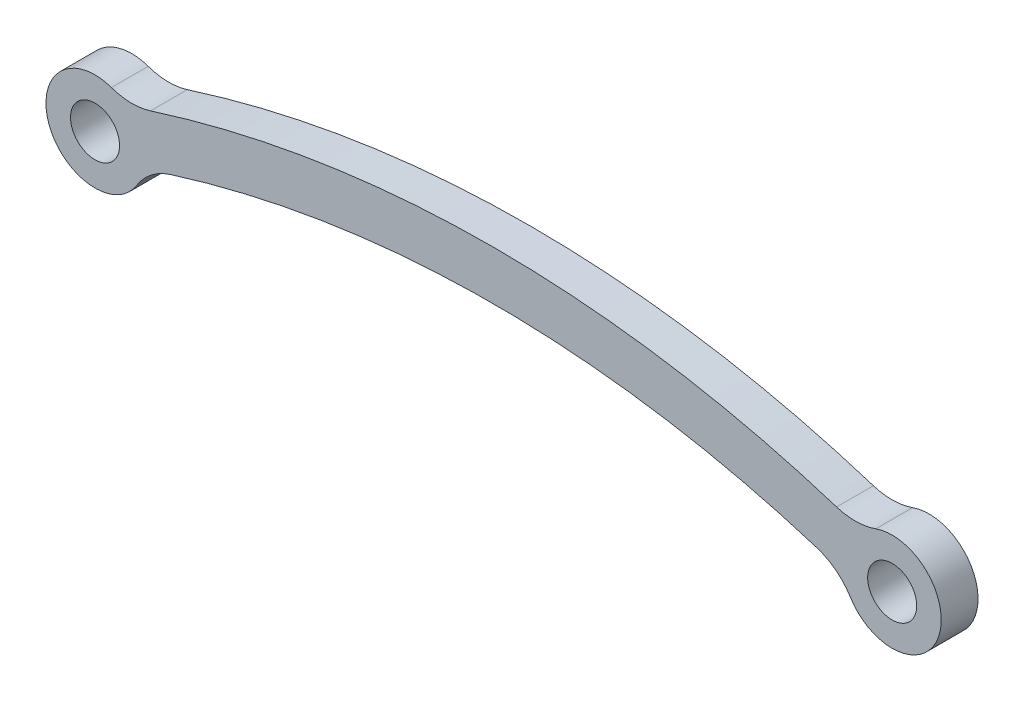
from build123d import *

# Parameters (mm, degrees)
SKETCH_1_R          = 8
EXTRUDE_1_DEPTH     = 6
SKETCH_2_R          = 4
CUT_EXTRUDE_1_DEPTH = 15
FILLET_1_R          = 10
EXTRUDE_START       = -6
EXTRUDE_3_DEPTH     = 6
CUT_EXTRUDE_START   = -6
CUT_EXTRUDE_2_DEPTH = 6
FILLET_2_R          = 10


with BuildPart() as part:
    # 草图1 → 凸台-拉伸1 (new body)
    with BuildSketch(Plane.XY):
        with Locations((-65, 0)):
            Circle(SKETCH_1_R)
        with Locations((65, 0)):
            Circle(SKETCH_1_R)
        with BuildLine():
            Line((-65, 4), (65, 4))
            ThreePointArc((65, 4), (69, 0), (65, -4))
            Line((65, -4), (-65, -4))
            ThreePointArc((-65, -4), (-69, 0), (-65, 4))
        make_face()
    extrude(amount=EXTRUDE_1_DEPTH)

    # 草图2 → 切除-拉伸1 (cut)
    with BuildSketch(Plane.XY.offset(6)):
        with Locations((-65, 0)):
            Circle(SKETCH_2_R)
        with Locations((65, 0)):
            Circle(SKETCH_2_R)
    extrude(amount=-CUT_EXTRUDE_1_DEPTH, mode=Mode.SUBTRACT)

    # 圆角1
    fillet_1_edges = [part.edges().sort_by_distance(p)[0] for p in [
        (58.07179677, -4, 3),
        (-58.07179677, -4, 3),
        (-58.07179677, 4, 3),
        (58.07179677, 4, 3),
    ]]
    fillet(fillet_1_edges, radius=FILLET_1_R)

    # 草图4 → 凸台-拉伸3 (add)
    with BuildSketch(Plane.XY.offset(6).offset(EXTRUDE_START)):
        with BuildLine():
            ThreePointArc((53.536596581, 4), (0, 12.145896684), (-53.536596581, 4))
            Line((-53.536596581, 4), (-37.975876204, 4))
            ThreePointArc((-37.975876204, 4), (0, 8.145896684), (37.975876204, 4))
            Line((37.975876204, 4), (53.536596581, 4))
        make_face()
        with BuildLine():
            ThreePointArc((59.862982118, 6.135618714), (0, 16.145896684), (-59.862982118, 6.135618714))
            ThreePointArc((-59.862982118, 6.135618714), (-56.954026736, 4.54897326), (-53.686291501, 4))
            Line((-53.686291501, 4), (-53.536596581, 4))
            ThreePointArc((-53.536596581, 4), (0, 12.145896684), (53.536596581, 4))
            Line((53.536596581, 4), (53.686291501, 4))
            ThreePointArc((53.686291501, 4), (56.954026736, 4.54897326), (59.862982118, 6.135618714))
        make_face()
    extrude(amount=EXTRUDE_3_DEPTH)

    # 草图5 → 切除-拉伸2 (cut)
    with BuildSketch(Plane.XY.offset(6).offset(CUT_EXTRUDE_START)):
        with BuildLine():
            ThreePointArc((-59.971685112, -6.222222222), (-57.019624834, -4.571909584), (-53.686291501, -4))
            Line((-53.686291501, -4), (53.686291501, -4))
            ThreePointArc((53.686291501, -4), (57.019624834, -4.571909584), (59.971685112, -6.222222222))
            ThreePointArc((59.971685112, -6.222222222), (58.106897, -4.060188546), (57.120098961, -1.380999498))
            ThreePointArc((57.120098961, -1.380999498), (47.624047624, 1.580102463), (37.975876204, 4))
            Line((37.975876204, 4), (-37.975876204, 4))
            ThreePointArc((-37.975876204, 4), (-47.624047624, 1.580102463), (-57.120098961, -1.380999498))
            ThreePointArc((-57.120098961, -1.380999498), (-58.106897, -4.060188546), (-59.971685112, -6.222222222))
        make_face()
    extrude(amount=CUT_EXTRUDE_2_DEPTH, mode=Mode.SUBTRACT)

    # 圆角2
    fillet_2_edges = [part.edges().sort_by_distance(p)[0] for p in [
        (-57.120098961, -1.380999498, 3),
    ]]
    fillet(fillet_2_edges, radius=FILLET_2_R)
    fillet_2_2_edges = [part.edges().sort_by_distance(p)[0] for p in [
        (59.862982118, 6.135618714, 3),
    ]]
    fillet(fillet_2_2_edges, radius=FILLET_2_R)
    fillet_2_3_edges = [part.edges().sort_by_distance(p)[0] for p in [
        (57.120098961, -1.380999498, 3),
    ]]
    fillet(fillet_2_3_edges, radius=FILLET_2_R)
    fillet_2_4_edges = [part.edges().sort_by_distance(p)[0] for p in [
        (-59.862982118, 6.135618714, 3),
    ]]
    fillet(fillet_2_4_edges, radius=FILLET_2_R)


solid = part.part
